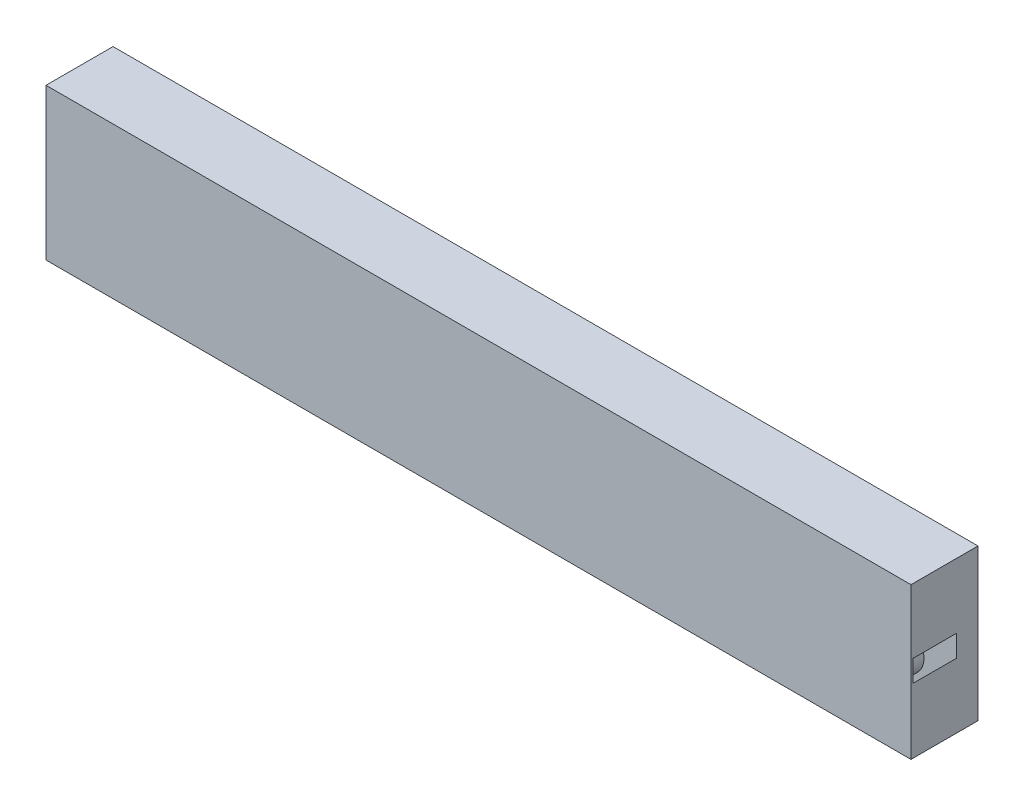
from build123d import *

# Parameters (mm, degrees)
SKETCH1_W           = 400
SKETCH1_H           = 70
BOSS_EXTRUDE1_DEPTH = 30
CUT_EXTRUDE1_DEPTH  = 20
FILLET1_R           = 0.1
FILLET2_START       = 10
FILLET2_DEPTH       = 21
BOSS_EXTRUDE2_DEPTH = 20
LPATTERN1_COUNT     = 4
LPATTERN1_PITCH     = 100
BOSS_EXTRUDE3_DEPTH = 20
LPATTERN2_COUNT     = 3
LPATTERN2_PITCH     = 100
SKETCH5_R           = 10
BOSS_EXTRUDE4_DEPTH = 20
SKETCH6_W           = 400
SKETCH6_H           = 70
BOSS_EXTRUDE5_DEPTH = 1


with BuildPart() as part:
    # Sketch1 → Boss-Extrude1 (new body)
    with BuildSketch(Plane.XY):
        Rectangle(SKETCH1_W, SKETCH1_H)
    extrude(amount=BOSS_EXTRUDE1_DEPTH)

    # Sketch2 → Cut-Extrude1 (cut)
    with BuildSketch(Plane.XY.offset(30)):
        with BuildLine():
            Line((-128.697541479, 4.604917042), (-175, -5))
            Line((-175, -5), (-200, -5))
            Line((-200, -5), (-200, 5))
            Line((-200, 5), (-190.811388301, 5))
            ThreePointArc((-190.811388301, 5), (-187.890958939, 24.335251481), (-168.875, 28.893119746))
            Line((-168.875, 28.893119746), (-81.125, -3.893119746))
            ThreePointArc((-81.125, -3.893119746), (-91.393119746, 18.625), (-68.875, 28.893119746))
            Line((-68.875, 28.893119746), (18.875, -3.893119746))
            ThreePointArc((18.875, -3.893119746), (8.606880254, 18.625), (31.125, 28.893119746))
            Line((31.125, 28.893119746), (118.875, -3.893119746))
            ThreePointArc((118.875, -3.893119746), (108.53578111, 18.431230593), (130.736636107, 29.033027738))
            Line((130.736636107, 29.033027738), (200, 5))
            Line((200, 5), (200, -5))
            Line((200, -5), (189.969387627, -21.564625424))
            ThreePointArc((189.969387627, -21.564625424), (161.524837834, -23.665572292), (168.875, 3.893119746))
            Line((168.875, 3.893119746), (81.125, -28.893119746))
            ThreePointArc((81.125, -28.893119746), (58.606880254, -18.625), (68.875, 3.893119746))
            Line((68.875, 3.893119746), (-18.875, -28.893119746))
            ThreePointArc((-18.875, -28.893119746), (-41.393119746, -18.625), (-31.125, 3.893119746))
            Line((-31.125, 3.893119746), (-118.875, -28.893119746))
            ThreePointArc((-118.875, -28.893119746), (-141.792937679, -17.424149076), (-128.697541479, 4.604917042))
        make_face()
    extrude(amount=-CUT_EXTRUDE1_DEPTH, mode=Mode.SUBTRACT)

    # Fillet1
    fillet1_edges = [part.edges().sort_by_distance(p)[0] for p in [
        (-128.697541479, 4.604917042, 20),
    ]]
    fillet(fillet1_edges, radius=FILLET1_R)

    # Fillet2: read off the stored shape, not the designer's step
    # Fillet2 outline → Fillet2 (cut)
    with BuildSketch(Plane.XY.offset(FILLET2_START)):
        with BuildLine():
            ThreePointArc((-33.603406746, 2.967106787), (-33.477636502, 2.91539326), (-33.519722617, 2.786082773))
            ThreePointArc((-33.519722617, 2.786082773), (-32.343252539, 3.384792796), (-31.125, 3.893119746))
            Line((-31.125, 3.893119746), (-33.603406746, 2.967106787))
        make_face()
        with BuildLine():
            ThreePointArc((66.396593254, 2.967106787), (66.522363498, 2.91539326), (66.480277383, 2.786082773))
            ThreePointArc((66.480277383, 2.786082773), (67.656747461, 3.384792796), (68.875, 3.893119746))
            Line((68.875, 3.893119746), (66.396593254, 2.967106787))
        make_face()
        with BuildLine():
            ThreePointArc((166.396593254, 2.967106787), (166.522363498, 2.91539326), (166.480277383, 2.786082773))
            ThreePointArc((166.480277383, 2.786082773), (167.656747461, 3.384792796), (168.875, 3.893119746))
            Line((168.875, 3.893119746), (166.396593254, 2.967106787))
        make_face()
        with BuildLine():
            ThreePointArc((116.480277383, -2.786082773), (116.522363498, -2.91539326), (116.396593254, -2.967106787))
            Line((116.396593254, -2.967106787), (118.875, -3.893119746))
            ThreePointArc((118.875, -3.893119746), (117.656747461, -3.384792796), (116.480277383, -2.786082773))
        make_face()
        with BuildLine():
            ThreePointArc((-81.125, -3.893119746), (-82.343252539, -3.384792796), (-83.519722617, -2.786082773))
            ThreePointArc((-83.519722617, -2.786082773), (-83.477636502, -2.91539326), (-83.603406746, -2.967106787))
            Line((-83.603406746, -2.967106787), (-81.125, -3.893119746))
        make_face()
        with BuildLine():
            ThreePointArc((16.480277383, -2.786082773), (16.522363498, -2.91539326), (16.396593254, -2.967106787))
            Line((16.396593254, -2.967106787), (18.875, -3.893119746))
            ThreePointArc((18.875, -3.893119746), (17.656747461, -3.384792796), (16.480277383, -2.786082773))
        make_face()
    extrude(amount=FILLET2_DEPTH, mode=Mode.SUBTRACT)

    # Sketch3 → Boss-Extrude2 (add)
    with BuildSketch(Plane.XY.offset(10)):
        with BuildLine():
            Line((-171, 3.33484861), (-150, 12.5))
            Line((-150, 12.5), (-171, 21.66515139))
            ThreePointArc((-171, 21.66515139), (-185, 12.5), (-171, 3.33484861))
        make_face()
    boss_extrude2 = extrude(amount=BOSS_EXTRUDE2_DEPTH)

    # LPattern1: Boss-Extrude2 ×4
    with Locations(*[(i * LPATTERN1_PITCH, 0, 0) for i in range(1, LPATTERN1_COUNT)]):
        add(boss_extrude2)

    # Sketch4 → Boss-Extrude3 (add)
    with BuildSketch(Plane.XY.offset(10)):
        with BuildLine():
            Line((-121, -21.66515139), (-100, -12.5))
            Line((-100, -12.5), (-121, -3.33484861))
            ThreePointArc((-121, -3.33484861), (-135, -12.5), (-121, -21.66515139))
        make_face()
    boss_extrude3 = extrude(amount=BOSS_EXTRUDE3_DEPTH)

    # LPattern2: Boss-Extrude3 ×3
    with Locations(*[(i * LPATTERN2_PITCH, 0, 0) for i in range(1, LPATTERN2_COUNT)]):
        add(boss_extrude3)

    # Sketch5 → Boss-Extrude4 (add)
    with BuildSketch(Plane.XY.offset(10)):
        with Locations((175, -12.5)):
            Circle(SKETCH5_R)
    extrude(amount=BOSS_EXTRUDE4_DEPTH)

    # Sketch6 → Boss-Extrude5 (add)
    with BuildSketch(Plane.XY.offset(30)):
        Rectangle(SKETCH6_W, SKETCH6_H)
    extrude(amount=BOSS_EXTRUDE5_DEPTH)


solid = part.part
